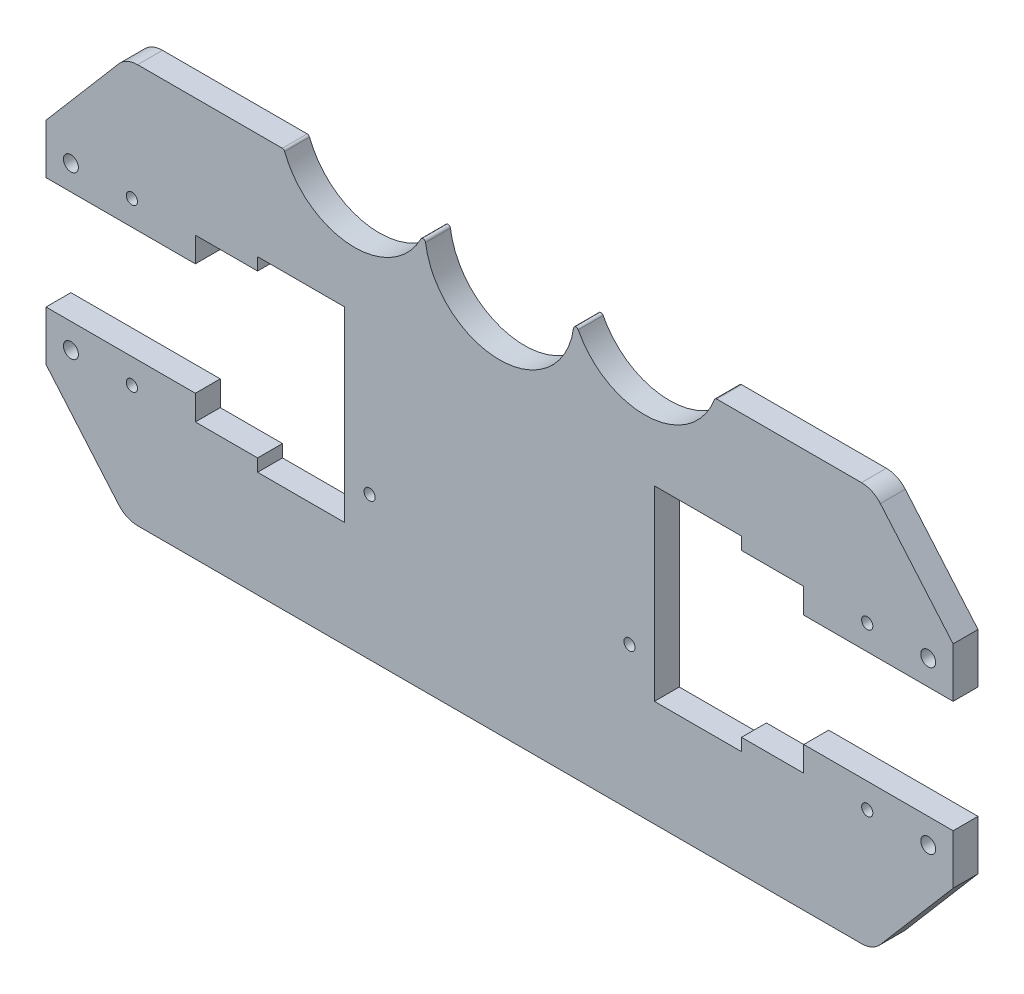
from build123d import *

# Parameters (mm, degrees)
BOSS_EXTRU_1_DEPTH           = 10
ENL_V_MAT_EXTRU_1_DEPTH      = 10
ENL_V_MAT_EXTRU_2_DEPTH      = 200.321047559
ENL_V_MAT_EXTRU_2_DEPTH_BACK = 10
ESQUISSE10_R                 = 2.25
ESQUISSE10_R_2               = 3
ENL_V_MAT_EXTRU_3_DEPTH      = 10
ESQUISSE15_R                 = 2.25
ENL_V_MAT_EXTRU_4_DEPTH      = 10
CONG_1_R                     = 10
CONG_3_R                     = 1


with BuildPart() as part:
    # Esquisse3 → Boss.-Extru.1 (new body)
    with BuildSketch(Plane.XY):
        Polygon((-150, 80.2), (-182.2, 42.5), (-182.2, -42.5), (-150, -80.2), (150, -80.2), (182.2, -42.5), (182.2, 42.5), (150, 80.2), align=None)
    extrude(amount=BOSS_EXTRU_1_DEPTH)

    # Esquisse4 → Enlèv. mat.-Extru.1 (cut)
    with BuildSketch(Plane.XY.offset(10)):
        Polygon((-97.2, 32.5), (-122.2, 32.5), (-122.2, 22.5), (-182.2, 22.5), (-182.2, -22.5), (-122.2, -22.5), (-122.2, -32.5), (-97.2, -32.5), (-97.2, -37.5), (-62.2, -37.5), (-62.2, 37.5), (-97.2, 37.5), align=None)
        Polygon((122.2, 22.5), (122.2, 32.5), (97.2, 32.5), (97.2, 37.5), (62.2, 37.5), (62.2, -37.5), (97.2, -37.5), (97.2, -32.5), (122.2, -32.5), (122.2, -22.5), (182.2, -22.5), (182.2, 22.5), align=None)
    extrude(amount=-ENL_V_MAT_EXTRU_1_DEPTH, mode=Mode.SUBTRACT)

    # Esquisse5 → Enlèv. mat.-Extru.2 (cut, two sides: drawn at the far end of the back side and taken through both)
    with BuildSketch(Plane.XY.offset(10).offset(-ENL_V_MAT_EXTRU_2_DEPTH_BACK)):
        with BuildLine():
            Line((298.563951853, 679.813566151), (86.568542495, 80.2))
            ThreePointArc((86.568542495, 80.2), (58.284271247, 60.2), (30, 80.2))
            ThreePointArc((30, 80.2), (0, 50.2), (-30, 80.2))
            ThreePointArc((-30, 80.2), (-58.284271247, 60.2), (-86.568542495, 80.2))
            Line((-86.568542495, 80.2), (-298.563951853, 679.813566151))
            Line((-298.563951853, 679.813566151), (-298.563951853, 1951.7860223))
            Line((-298.563951853, 1951.7860223), (298.563951853, 1951.7860223))
            Line((298.563951853, 1951.7860223), (298.563951853, 679.813566151))
        make_face()
    extrude(amount=ENL_V_MAT_EXTRU_2_DEPTH + ENL_V_MAT_EXTRU_2_DEPTH_BACK, mode=Mode.SUBTRACT)

    # Esquisse10 → Enlèv. mat.-Extru.3 (cut)
    with BuildSketch(Plane.XY.offset(10)):
        with Locations((-147.7, 32.5)):
            Circle(ESQUISSE10_R)
        with Locations((-172.2, 32.5)):
            Circle(ESQUISSE10_R_2)
        with Locations((-172.2, -32.5)):
            Circle(ESQUISSE10_R_2)
        with Locations((-147.7, -32.5)):
            Circle(ESQUISSE10_R)
        with Locations((172.2, 32.5)):
            Circle(ESQUISSE10_R_2)
        with Locations((147.7, 32.5)):
            Circle(ESQUISSE10_R)
        with Locations((172.2, -32.5)):
            Circle(ESQUISSE10_R_2)
        with Locations((147.7, -32.5)):
            Circle(ESQUISSE10_R)
    extrude(amount=-ENL_V_MAT_EXTRU_3_DEPTH, mode=Mode.SUBTRACT)

    # Esquisse15 → Enlèv. mat.-Extru.4 (cut)
    with BuildSketch(Plane.XY.offset(10)):
        with Locations((-52.2, -22.7)):
            Circle(ESQUISSE15_R)
        with Locations((52.2, -22.7)):
            Circle(ESQUISSE15_R)
    extrude(amount=-ENL_V_MAT_EXTRU_4_DEPTH, mode=Mode.SUBTRACT)

    # Congé1
    cong_1_edges = [part.edges().sort_by_distance(p)[0] for p in [
        (150, 80.2, 5),
        (150, -80.2, 5),
        (-150, 80.2, 5),
        (-150, -80.2, 5),
    ]]
    fillet(cong_1_edges, radius=CONG_1_R)

    # Congé3
    cong_3_edges = [part.edges().sort_by_distance(p)[0] for p in [
        (-86.568542495, 80.2, 5),
        (-30, 80.2, 5),
        (30, 80.2, 5),
        (86.568542495, 80.2, 5),
    ]]
    fillet(cong_3_edges, radius=CONG_3_R)


solid = part.part
